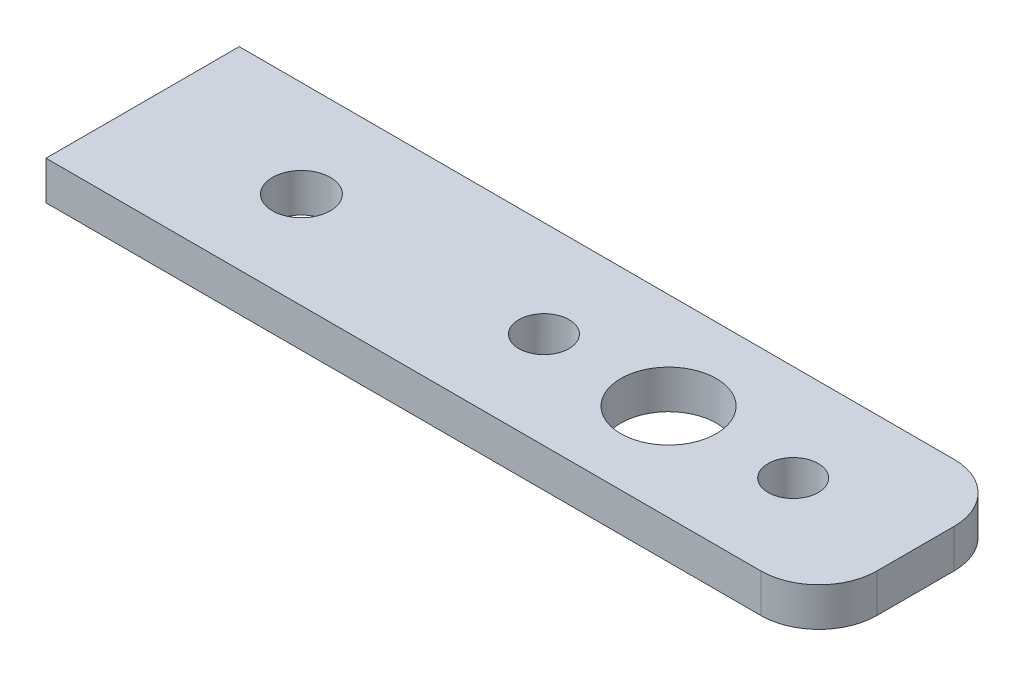
from build123d import *

# Parameters (mm, degrees)
SKETCH1_W                = 40
SKETCH1_H                = 10
BOSS_EXTRUDE1_DEPTH      = 2
SKETCH2_R                = 2.472864358
SKETCH2_R_2              = 1.3
CUT_EXTRUDE1_DEPTH       = 3
FILLET1_R                = 3
F_3_0_3_DIAMETER_HOLE1_D = 3


with BuildPart() as part:
    # Sketch1 → Boss-Extrude1 (new body)
    with BuildSketch(Plane(origin=(0, 0, 0), x_dir=(1, 0, 0), z_dir=(0, 1, 0))):
        Rectangle(SKETCH1_W, SKETCH1_H)
    extrude(amount=BOSS_EXTRUDE1_DEPTH)

    # Sketch2 → Cut-Extrude1 (cut)
    with BuildSketch(Plane(origin=(0, 2, 0), x_dir=(1, 0, 0), z_dir=(0, 1, 0))):
        with Locations((7.219918586, 0)):
            Circle(SKETCH2_R)
        with Locations((13.669918586, 0)):
            Circle(SKETCH2_R_2)
        with Locations((0.769918586, 0)):
            Circle(SKETCH2_R_2)
    extrude(amount=-CUT_EXTRUDE1_DEPTH, mode=Mode.SUBTRACT)

    # Fillet1
    fillet1_edges = [part.edges().sort_by_distance(p)[0] for p in [
        (20, 1, 5),
        (20, 1, -5),
    ]]
    fillet(fillet1_edges, radius=FILLET1_R)

    # Ø3.0 (3) Diameter Hole1 (through all)
    with Locations(Plane(origin=(0, 2, 0), x_dir=(1, 0, 0), z_dir=(0, 1, 0))):
        with Locations((-11.781269776, 0)):
            Hole(F_3_0_3_DIAMETER_HOLE1_D / 2)


solid = part.part
